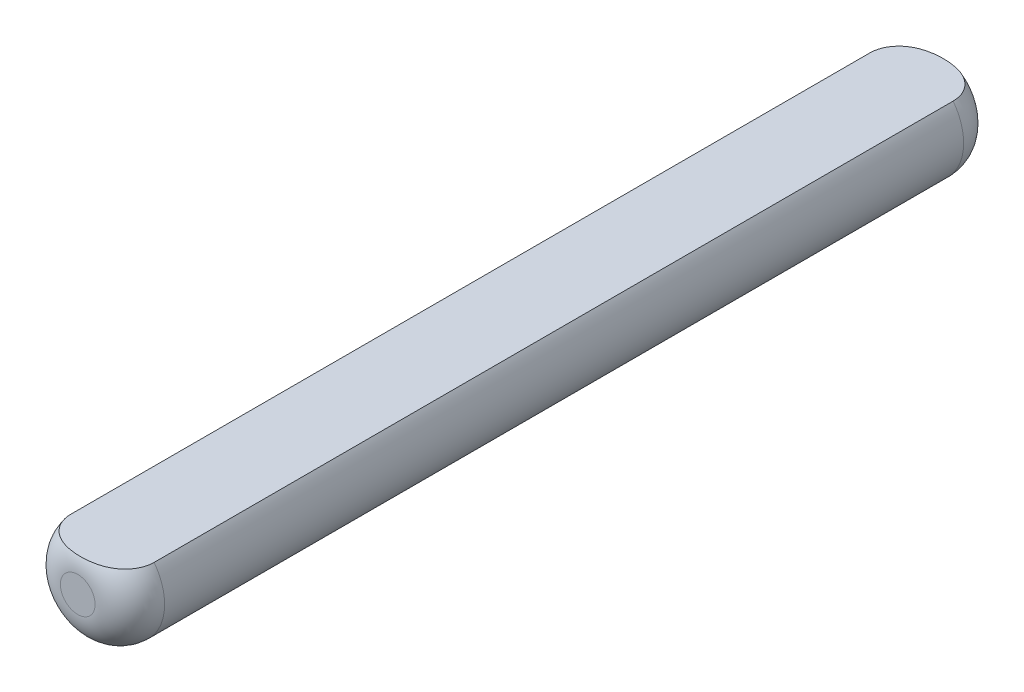
from build123d import *

# Parameters (mm, degrees)
ESQUISSE1_R             = 3
BOSS_EXTRU_1_DEPTH      = 50
CONG_1_R                = 2
ESQUISSE2_W             = 6
ESQUISSE2_H             = 1.2
ENL_V_MAT_EXTRU_1_DEPTH = 51.179677167


with BuildPart() as part:
    # Esquisse1 → Boss.-Extru.1 (new body)
    with BuildSketch(Plane.XY):
        Circle(ESQUISSE1_R)
    extrude(amount=BOSS_EXTRU_1_DEPTH)

    # Congé1
    cong_1_edges = [part.edges().sort_by_distance(p)[0] for p in [
        (-3, 0, 0),
        (-3, 0, 50),
    ]]
    fillet(cong_1_edges, radius=CONG_1_R)

    # Esquisse2 → Enlèv. mat.-Extru.1 (cut, through all)
    with BuildSketch(Plane.XY.offset(50)):
        with Locations((0, 2.4)):
            Rectangle(ESQUISSE2_W, ESQUISSE2_H)
    extrude(amount=-ENL_V_MAT_EXTRU_1_DEPTH, mode=Mode.SUBTRACT)


solid = part.part
